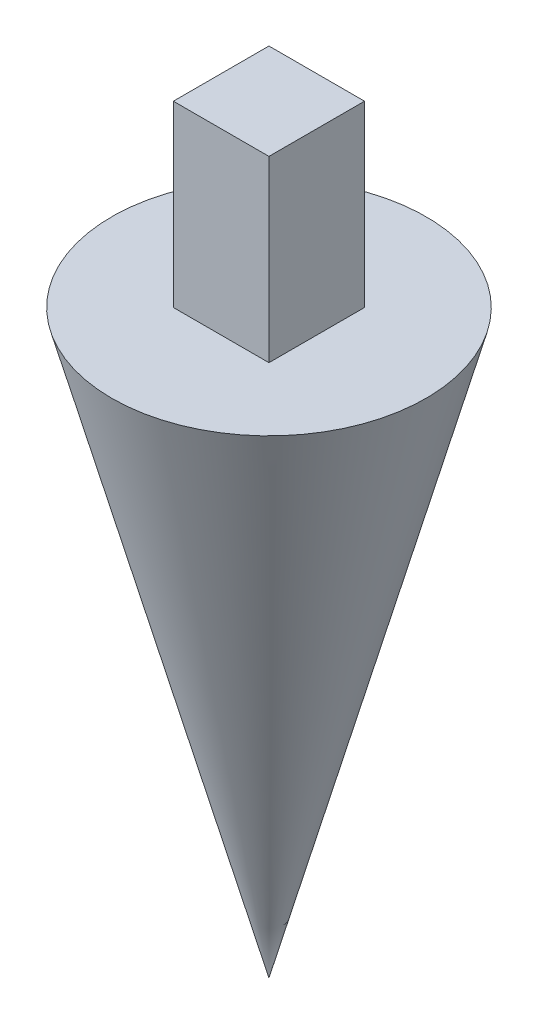
from build123d import *

# Parameters (mm, degrees)
SKETCH2_W           = 6.7945
SKETCH2_H           = 6.7945
BOSS_EXTRUDE1_DEPTH = 12.7


with BuildPart() as part:
    # Sketch1 → Revolve1 (revolve)
    with BuildSketch(Plane(origin=(0, 0, 0), x_dir=(0, 0, -1), z_dir=(1, 0, 0))):
        Polygon((0, 0), (0, -41.275), (11.176, 0), align=None)
    revolve(axis=Axis((0, 0, 0), (0, -1, 0)))

    # Sketch2 → Boss-Extrude1 (add)
    with BuildSketch(Plane(origin=(0, 0, 0), x_dir=(1, 0, 0), z_dir=(0, 1, 0))):
        Rectangle(SKETCH2_W, SKETCH2_H)
    extrude(amount=BOSS_EXTRUDE1_DEPTH)


solid = part.part
